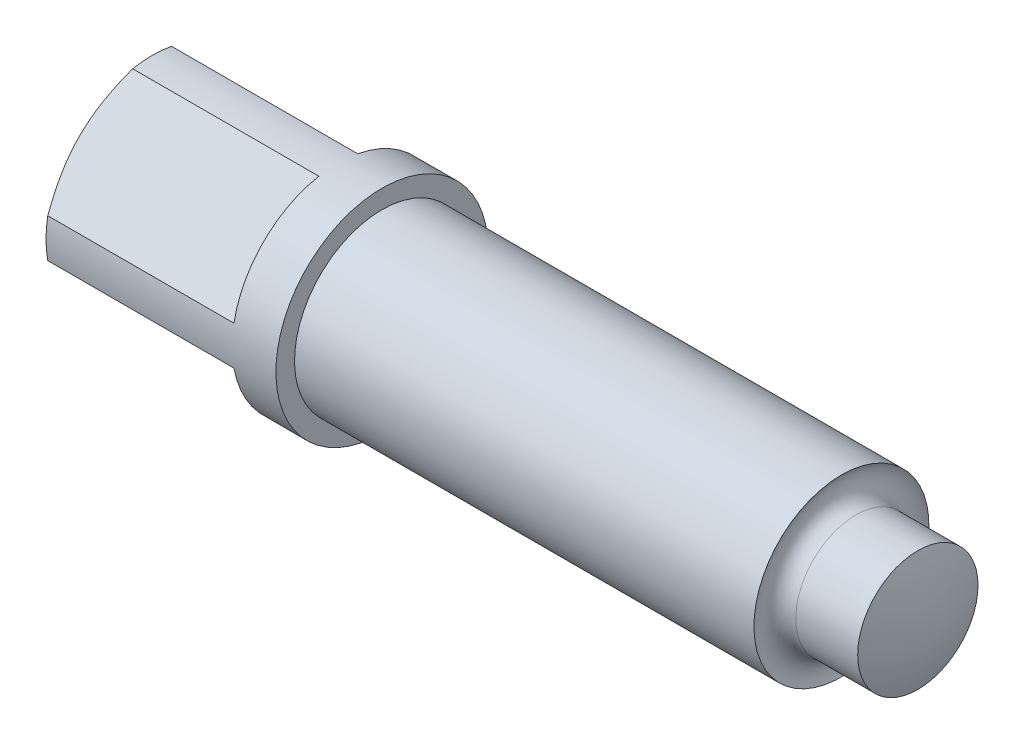
from build123d import *

# Parameters (mm, degrees)
SKETCH1_R          = 4.85
BASEHEAD_DEPTH     = 11
SKETCH2_OUTSIDE_W  = 15.216
SKETCH2_OUTSIDE_H  = 15.216
CUT_EXTRUDE1_DEPTH = 9


with BuildPart() as part:
    # Sketch1 → BaseHead (new body)
    with BuildSketch(Plane(origin=(0, 0, 0), x_dir=(0, 0, -1), z_dir=(1, 0, 0))):
        Circle(SKETCH1_R)
    extrude(amount=BASEHEAD_DEPTH)

    # Sketch2 outside → Cut-Extrude1 (cut)
    with BuildSketch(Plane(origin=(0, -0.474673428, 1.649883568), x_dir=(0, 0, 1), z_dir=(-1, 0, 0))):
        with Locations((-1.65, 0.475)):
            Rectangle(SKETCH2_OUTSIDE_W, SKETCH2_OUTSIDE_H)
        Polygon((4.006970681, 0.474673428), (-1.649883568, 6.131527678), (-7.306737818, 0.474673428), (-1.649883568, -5.182180821), align=None, mode=Mode.SUBTRACT)
    extrude(amount=-CUT_EXTRUDE1_DEPTH, mode=Mode.SUBTRACT)

    # Sketch3 → Cut-Revolve1 (revolve, cut)
    with BuildSketch(Plane(origin=(2.689716749, -8.024716749, 0), x_dir=(0, -1, 0), z_dir=(0, 0, 1))):
        Polygon((-13.359716749, -2.689716749), (-12.024716749, -2.689716749), (-13.359716749, -1.918954139), align=None)
    revolve(axis=Axis((2.975283251, 0, 0), (-1, 0, 0)), mode=Mode.SUBTRACT)

    # Sketch4 → BaseBody (revolve)
    with BuildSketch(Plane(origin=(-9.880205812, 13.880205812, 0), x_dir=(0, -1, 0), z_dir=(0, 0, 1))):
        with BuildLine():
            Line((13.880205812, 20.880205812), (17.880205812, 20.880205812))
            Line((17.880205812, 20.880205812), (17.880205812, 41.880205812))
            ThreePointArc((17.880205812, 41.880205812), (17.056040073, 41.834536858), (16.630205812, 42.541643639))
            Line((16.630205812, 42.541643639), (16.630205812, 45.372389068))
            ThreePointArc((16.630205812, 45.372389068), (15.278452736, 45.752187424), (13.880205812, 45.880205812))
            Line((13.880205812, 45.880205812), (13.880205812, 20.880205812))
        make_face()
    revolve(axis=Axis((2.816383264, 0, 0), (-1, 0, 0)))


solid = part.part
